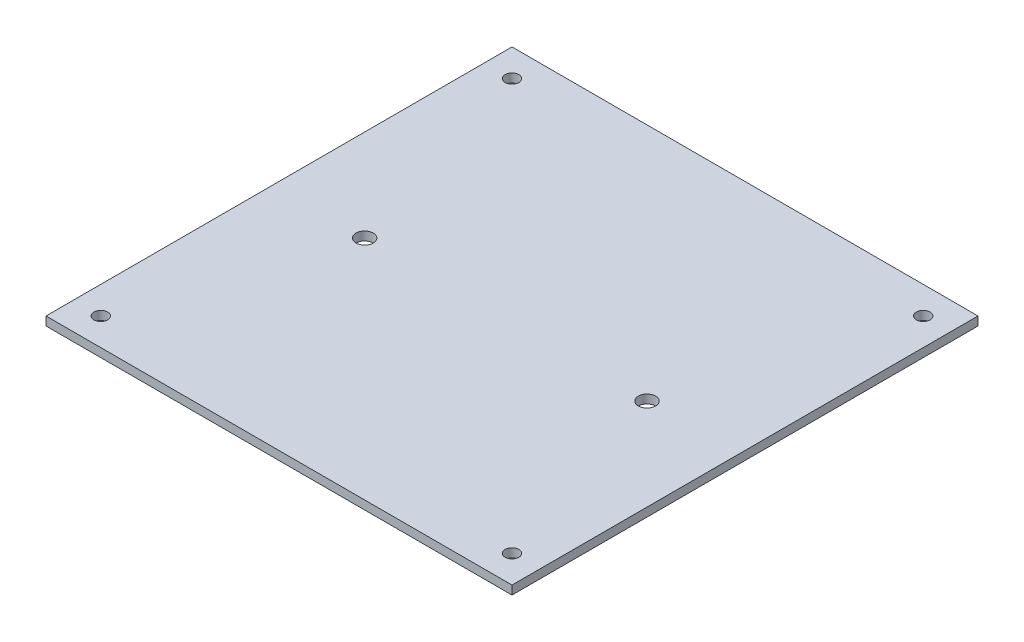
from build123d import *

# Parameters (mm, degrees)
SKETCH1_W           = 170
SKETCH1_H           = 170
SKETCH1_R           = 2.5
SKETCH1_R_2         = 3.15
BOSS_EXTRUDE1_DEPTH = 3.175


with BuildPart() as part:
    # Sketch1 → Boss-Extrude1 (new body)
    with BuildSketch(Plane(origin=(0, 0, 0), x_dir=(1, 0, 0), z_dir=(0, 1, 0))):
        Rectangle(SKETCH1_W, SKETCH1_H)
        with Locations((-75, -75)):
            Circle(SKETCH1_R, mode=Mode.SUBTRACT)
        with Locations((75, -75)):
            Circle(SKETCH1_R, mode=Mode.SUBTRACT)
        with Locations((-75, 75)):
            Circle(SKETCH1_R, mode=Mode.SUBTRACT)
        with Locations((75, 75)):
            Circle(SKETCH1_R, mode=Mode.SUBTRACT)
        with Locations((-51.5, -2.25)):
            Circle(SKETCH1_R_2, mode=Mode.SUBTRACT)
        with Locations((51.5, -2.25)):
            Circle(SKETCH1_R_2, mode=Mode.SUBTRACT)
    extrude(amount=BOSS_EXTRUDE1_DEPTH)


solid = part.part
